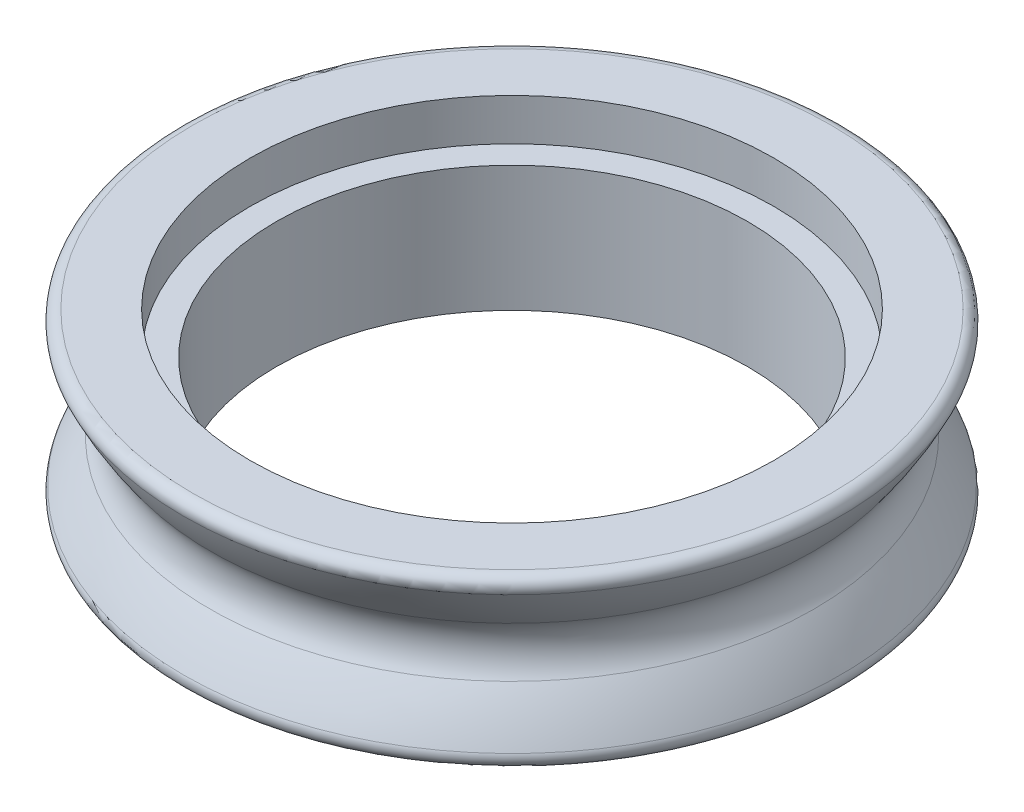
from build123d import *

# Parameters (mm, degrees)
FILLET1_R          = 16.51
FILLET2_R          = 0.635
SKETCH2_R          = 15.875
CUT_EXTRUDE1_DEPTH = 2.54


with BuildPart() as part:
    # Sketch1 → Revolve1 (revolve)
    with BuildSketch(Plane.XY, mode=Mode.PRIVATE) as revolve1_sk:
        with BuildLine():
            Line((14.2875, 5.08), (14.2875, -5.08))
            Line((14.2875, -5.08), (20.32, -5.08))
            Line((20.32, -5.08), (20.32, -2.54))
            ThreePointArc((20.32, -2.54), (17.78, 0), (20.32, 2.54))
            Line((20.32, 2.54), (20.32, 5.08))
            Line((20.32, 5.08), (14.2875, 5.08))
        make_face()
    revolve(revolve1_sk.sketch.rotate(Axis((0, 5.08, 0), (0, -1, 0)), 90), axis=Axis((0, 5.08, 0), (0, -1, 0)))

    # Fillet1
    # the kernel refuses this fillet: 16.51 mm, written as the material it takes off along each edge
    with BuildSketch(Plane(origin=(0, 2.54, 0), x_dir=(0, 0, 1), z_dir=(1, 0, 0))) as fillet1_piece_1:
        with BuildLine():
            CenterArc((5.08, -8.89), FILLET1_R, 22.619864948, 14.250032698)
            Line((18.288, 1.016), (18.55216, 1.21412))
            ThreePointArc((18.55216, 1.21412), (19.331747397, 0.563494793), (20.32, 0.3302))
            Line((20.32, 0.3302), (20.6502, 0))
            ThreePointArc((20.6502, 0), (20.6502, -1.27), (20.6248, -2.413))
            Line((20.6248, -2.413), (20.32, -2.54))
        make_face()
    revolve(axis=Axis((0, 2.54, 0), (0, -1, 0)), mode=Mode.SUBTRACT)
    with BuildSketch(Plane(origin=(0, -2.54, 0), x_dir=(0, 0, 1), z_dir=(1, 0, 0))) as fillet1_piece_2:
        with BuildLine():
            CenterArc((5.08, 8.89), FILLET1_R, 323.130102354, 14.250032698)
            Line((18.288, -1.016), (18.55216, -1.21412))
            ThreePointArc((18.55216, -1.21412), (19.331747397, -0.563494793), (20.32, -0.3302))
            Line((20.32, -0.3302), (20.6502, 0))
            ThreePointArc((20.6502, 0), (20.6502, 1.27), (20.6248, 2.413))
            Line((20.6248, 2.413), (20.32, 2.54))
        make_face()
    revolve(axis=Axis((0, -2.54, 0), (0, -1, 0)), mode=Mode.SUBTRACT)

    # Fillet2
    fillet2_edges = [part.edges().sort_by_distance(p)[0] for p in [
        (0, 5.08, -20.32),
        (0, -5.08, -20.32),
    ]]
    fillet(fillet2_edges, radius=FILLET2_R)

    # Sketch2 → Cut-Extrude1 (cut)
    with BuildSketch(Plane(origin=(0, 5.08, 0), x_dir=(1, 0, 0), z_dir=(0, 1, 0))):
        with Locations(Location((0, 0, 0), (0, 0, 270))):
            Circle(SKETCH2_R)
    extrude(amount=-CUT_EXTRUDE1_DEPTH, mode=Mode.SUBTRACT)


solid = part.part
